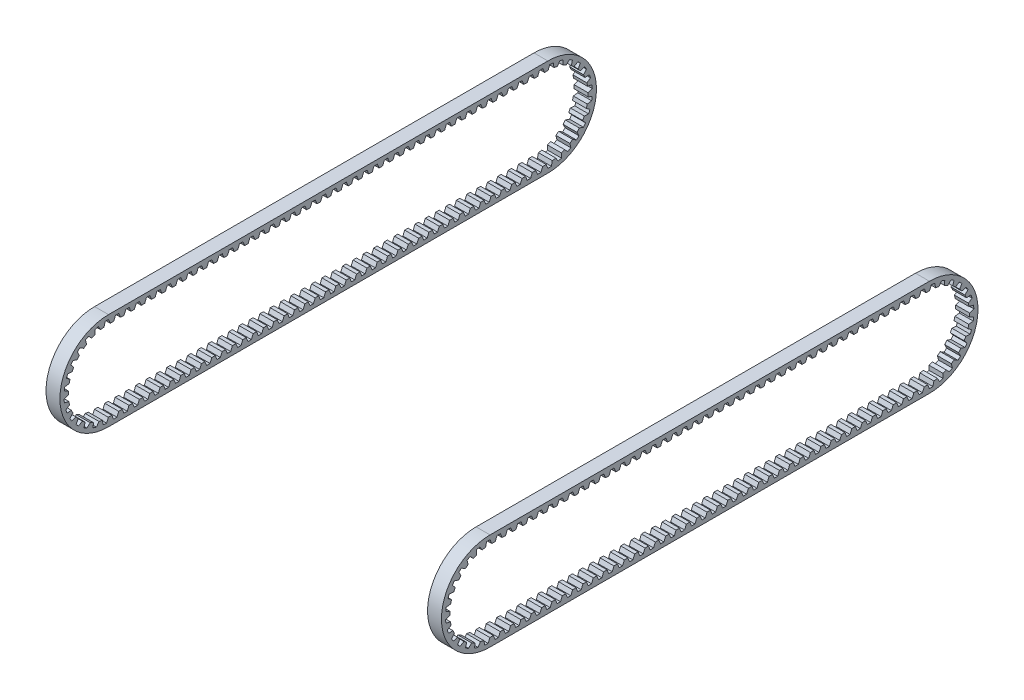
from build123d import *

# Parameters (mm, degrees)
EXTRUDE_THIN1_DEPTH = 2.000000064
BOSS_EXTRUDE1_DEPTH = 4.000000128
CRVPATTERN1_START   = 52.812499888
CRVPATTERN1_DEPTH   = 4.000000128


# Read off the part's stored shape, not the designer's step: CrvPattern1
with BuildPart() as part:
    # Sketch1 → Extrude-Thin1 (new, symmetric)
    with BuildSketch(Plane.ZY.offset(-54.812499952)):
        with BuildLine():
            Line((0, -13.959015611), (126.249998656, -13.959015611))
            ThreePointArc((126.249998656, -13.959015611), (140.209014267, 0), (126.249998656, 13.959015611))
            Line((126.249998656, 13.959015611), (0, 13.959015611))
            ThreePointArc((0, 13.959015611), (-13.959015611, 0), (0, -13.959015611))
        make_face()
        with BuildLine():
            Line((0, -12.779015685), (126.249998656, -12.779015685))
            ThreePointArc((126.249998656, -12.779015685), (139.029014341, 0), (126.249998656, 12.779015685))
            Line((126.249998656, 12.779015685), (0, 12.779015685))
            ThreePointArc((0, 12.779015685), (-12.779015685, 0), (0, -12.779015685))
        make_face(mode=Mode.SUBTRACT)
    extrude(amount=EXTRUDE_THIN1_DEPTH, both=True)

    # Sketch3 → Boss-Extrude1 (add)
    with BuildSketch(Plane.ZY.offset(-52.812499888)):
        Polygon((124.249998592, 12.779015685), (124.749998608, 11.559015585), (125.249998624, 11.559015585), (125.74999864, 11.559015585), (126.249998656, 12.779015685), (125.249998624, 12.779015685), align=None)
    extrude(amount=-BOSS_EXTRUDE1_DEPTH)

    # CrvPattern1 outline → CrvPattern1 (add)
    with BuildSketch(Plane.YZ.offset(CRVPATTERN1_START)):
        with BuildLine():
            Line((12.779015685, 1.452653318), (11.559015585, 0.952653302))
            Line((11.559015585, 0.952653302), (11.559015585, -0.04734673))
            Line((11.559015585, -0.04734673), (12.767490044, -0.542623123))
            ThreePointArc((12.767490044, -0.542623123), (12.77613395, -0.271372757), (12.779015685, 0))
            Line((12.779015685, 0), (12.779015685, 1.452653318))
        make_face()
        Polygon((11.559015585, 121.778633243), (12.779015685, 121.278633227), (12.779015685, 123.278633291), (11.559015585, 122.778633275), align=None)
        Polygon((11.559015585, 118.807267878), (12.779015685, 118.307267862), (12.779015685, 120.307267926), (11.559015585, 119.80726791), align=None)
        Polygon((11.559015585, 115.835902512), (12.779015685, 115.335902496), (12.779015685, 117.33590256), (11.559015585, 116.835902544), align=None)
        Polygon((11.559015585, 112.864537147), (12.779015685, 112.364537131), (12.779015685, 114.364537195), (11.559015585, 113.864537179), align=None)
        Polygon((11.559015585, 109.893171782), (12.779015685, 109.393171766), (12.779015685, 111.39317183), (11.559015585, 110.893171814), align=None)
        Polygon((11.559015585, 106.921806417), (12.779015685, 106.421806401), (12.779015685, 108.421806465), (11.559015585, 107.921806449), align=None)
        Polygon((11.559015585, 103.950441052), (12.779015685, 103.450441036), (12.779015685, 105.4504411), (11.559015585, 104.950441084), align=None)
        Polygon((11.559015585, 100.979075686), (12.779015685, 100.47907567), (12.779015685, 102.479075734), (11.559015585, 101.979075718), align=None)
        Polygon((11.559015585, 98.007710321), (12.779015685, 97.507710305), (12.779015685, 99.507710369), (11.559015585, 99.007710353), align=None)
        Polygon((11.559015585, 95.036344956), (12.779015685, 94.53634494), (12.779015685, 96.536345004), (11.559015585, 96.036344988), align=None)
        Polygon((11.559015585, 92.064979591), (12.779015685, 91.564979575), (12.779015685, 93.564979639), (11.559015585, 93.064979623), align=None)
        Polygon((11.559015585, 89.093614226), (12.779015685, 88.59361421), (12.779015685, 90.593614274), (11.559015585, 90.093614258), align=None)
        Polygon((11.559015585, 86.122248861), (12.779015685, 85.622248845), (12.779015685, 87.622248909), (11.559015585, 87.122248893), align=None)
        Polygon((11.559015585, 83.150883495), (12.779015685, 82.650883479), (12.779015685, 84.650883543), (11.559015585, 84.150883527), align=None)
        Polygon((11.559015585, 80.17951813), (12.779015685, 79.679518114), (12.779015685, 81.679518178), (11.559015585, 81.179518162), align=None)
        Polygon((11.559015585, 77.208152765), (12.779015685, 76.708152749), (12.779015685, 78.708152813), (11.559015585, 78.208152797), align=None)
        Polygon((11.559015585, 74.2367874), (12.779015685, 73.736787384), (12.779015685, 75.736787448), (11.559015585, 75.236787432), align=None)
        Polygon((11.559015585, 71.265422035), (12.779015685, 70.765422019), (12.779015685, 72.765422083), (11.559015585, 72.265422067), align=None)
        Polygon((11.559015585, 68.294056669), (12.779015685, 67.794056653), (12.779015685, 69.794056717), (11.559015585, 69.294056701), align=None)
        Polygon((11.559015585, 65.322691304), (12.779015685, 64.822691288), (12.779015685, 66.822691352), (11.559015585, 66.322691336), align=None)
        Polygon((11.559015585, 62.351325939), (12.779015685, 61.851325923), (12.779015685, 63.851325987), (11.559015585, 63.351325971), align=None)
        Polygon((11.559015585, 59.379960574), (12.779015685, 58.879960558), (12.779015685, 60.879960622), (11.559015585, 60.379960606), align=None)
        Polygon((11.559015585, 56.408595209), (12.779015685, 55.908595193), (12.779015685, 57.908595257), (11.559015585, 57.408595241), align=None)
        Polygon((11.559015585, 53.437229843), (12.779015685, 52.937229827), (12.779015685, 54.937229891), (11.559015585, 54.437229875), align=None)
        Polygon((11.559015585, 50.465864478), (12.779015685, 49.965864462), (12.779015685, 51.965864526), (11.559015585, 51.46586451), align=None)
        Polygon((11.559015585, 47.494499113), (12.779015685, 46.994499097), (12.779015685, 48.994499161), (11.559015585, 48.494499145), align=None)
        Polygon((11.559015585, 44.523133748), (12.779015685, 44.023133732), (12.779015685, 46.023133796), (11.559015585, 45.52313378), align=None)
        Polygon((11.559015585, 41.551768383), (12.779015685, 41.051768367), (12.779015685, 43.051768431), (11.559015585, 42.551768415), align=None)
        Polygon((11.559015585, 38.580403018), (12.779015685, 38.080403002), (12.779015685, 40.080403065), (11.559015585, 39.580403049), align=None)
        Polygon((11.559015585, 35.609037652), (12.779015685, 35.109037636), (12.779015685, 37.1090377), (11.559015585, 36.609037684), align=None)
        Polygon((11.559015585, 32.637672287), (12.779015685, 32.137672271), (12.779015685, 34.137672335), (11.559015585, 33.637672319), align=None)
        Polygon((11.559015585, 29.666306922), (12.779015685, 29.166306906), (12.779015685, 31.16630697), (11.559015585, 30.666306954), align=None)
        Polygon((11.559015585, 26.694941557), (12.779015685, 26.194941541), (12.779015685, 28.194941605), (11.559015585, 27.694941589), align=None)
        Polygon((11.559015585, 23.723576192), (12.779015685, 23.223576176), (12.779015685, 25.22357624), (11.559015585, 24.723576224), align=None)
        Polygon((11.559015585, 20.752210826), (12.779015685, 20.25221081), (12.779015685, 22.252210874), (11.559015585, 21.752210858), align=None)
        Polygon((11.559015585, 17.780845461), (12.779015685, 17.280845445), (12.779015685, 19.280845509), (11.559015585, 18.780845493), align=None)
        Polygon((11.559015585, 14.809480096), (12.779015685, 14.30948008), (12.779015685, 16.309480144), (11.559015585, 15.809480128), align=None)
        Polygon((11.559015585, 11.838114731), (12.779015685, 11.338114715), (12.779015685, 13.338114779), (11.559015585, 12.838114763), align=None)
        Polygon((11.559015585, 8.866749366), (12.779015685, 8.36674935), (12.779015685, 10.366749414), (11.559015585, 9.866749398), align=None)
        Polygon((11.559015585, 5.895384), (12.779015685, 5.395383984), (12.779015685, 7.395384048), (11.559015585, 6.895384032), align=None)
        Polygon((11.559015585, 2.924018635), (12.779015685, 2.424018619), (12.779015685, 4.424018683), (11.559015585, 3.924018667), align=None)
        with BuildLine():
            ThreePointArc((12.740999455, 127.234973155), (12.627259855, 128.213554214), (12.43847286, 129.180465305))
            Line((12.43847286, 129.180465305), (11.344920393, 128.52015781))
            Line((11.344920393, 128.52015781), (11.498575077, 127.532033171))
            Line((11.498575077, 127.532033171), (12.740999455, 127.234973155))
        make_face()
        with BuildLine():
            ThreePointArc((12.171159238, 130.144369553), (11.83498647, 131.070407056), (11.428475013, 131.967795501))
            Line((11.428475013, 131.967795501), (10.516505503, 131.073270711))
            Line((10.516505503, 131.073270711), (10.893718323, 130.147144072))
            Line((10.893718323, 130.147144072), (12.171159238, 130.144369553))
        make_face()
        with BuildLine():
            ThreePointArc((10.946243023, 132.844163163), (10.405730574, 133.667815929), (9.80337391, 134.447382499))
            Line((9.80337391, 134.447382499), (9.12207137, 133.366785517))
            Line((9.12207137, 133.366785517), (9.702539983, 132.552502855))
            Line((9.702539983, 132.552502855), (10.946243023, 132.844163163))
        make_face()
        with BuildLine():
            ThreePointArc((9.132178238, 135.189045725), (8.416417562, 135.865983124), (7.650635724, 136.485769994))
            Line((7.650635724, 136.485769994), (7.236669213, 135.277260699))
            Line((7.236669213, 135.277260699), (7.989151643, 134.618648327))
            Line((7.989151643, 134.618648327), (9.132178238, 135.189045725))
        make_face()
        with BuildLine():
            ThreePointArc((6.826601457, 137.052810994), (5.974116219, 137.546598909), (5.086125109, 137.973247918))
            Line((5.086125109, 137.973247918), (4.961775126, 136.701870684))
            Line((4.961775126, 136.701870684), (5.845771272, 136.23437643))
            Line((5.845771272, 136.23437643), (6.826601457, 137.052810994))
        make_face()
        with BuildLine():
            ThreePointArc((4.153603408, 138.335147418), (3.210276057, 138.619209201), (2.247869123, 138.82975725))
            Line((2.247869123, 138.82975725), (2.419828433, 137.563940129))
            Line((2.419828433, 137.563940129), (3.387759865, 137.312725463))
            Line((3.387759865, 137.312725463), (4.153603408, 138.335147418))
        make_face()
        with BuildLine():
            ThreePointArc((1.257050162, 138.967037099), (0.273652454, 139.02608398), (-0.711371649, 139.009198954))
            Line((-0.711371649, 139.009198954), (-0.252358238, 137.817070741))
            Line((-0.252358238, 137.817070741), (0.747412483, 137.795656536))
            Line((0.747412483, 137.795656536), (1.257050162, 138.967037099))
        make_face()
        with BuildLine():
            ThreePointArc((-1.707160023, 138.914470478), (-2.677699669, 138.745324437), (-3.632324984, 138.501915122))
            Line((-3.632324984, 138.501915122), (-2.910962488, 137.447638528))
            Line((-2.910962488, 137.447638528), (-1.933162125, 137.657177339))
            Line((-1.933162125, 137.657177339), (-1.707160023, 138.914470478))
        make_face()
        with BuildLine():
            ThreePointArc((-4.579487461, 138.180276795), (-5.48493267, 137.792041607), (-6.357779364, 137.335208777))
            Line((-6.357779364, 137.335208777), (-5.412892947, 136.475527065))
            Line((-5.412892947, 136.475527065), (-4.509690102, 136.904741097))
            Line((-4.509690102, 136.904741097), (-4.579487461, 138.180276795))
        make_face()
        with BuildLine():
            ThreePointArc((-7.205337775, 136.803971814), (-7.996955685, 136.21754307), (-8.741045414, 135.571874376))
            Line((-8.741045414, 135.571874376), (-7.623490741, 134.953057326))
            Line((-7.623490741, 134.953057326), (-6.843497589, 135.578845426))
            Line((-6.843497589, 135.578845426), (-7.205337775, 136.803971814))
        make_face()
        with BuildLine():
            ThreePointArc((-9.443382479, 134.859631007), (-10.07856664, 134.106571469), (-10.653851014, 133.306818084))
            Line((-10.653851014, 133.306818084), (-9.423777102, 132.96217166))
            Line((-9.423777102, 132.96217166), (-8.808974424, 133.750852667))
            Line((-8.808974424, 133.750852667), (-9.443382479, 134.859631007))
        make_face()
        with BuildLine():
            ThreePointArc((-11.173165557, 132.451902663), (-11.617729094, 131.572743491), (-11.993245164, 130.661949734))
            Line((-11.993245164, 130.661949734), (-10.716857036, 130.610023493))
            Line((-10.716857036, 130.610023493), (-10.300334736, 131.519149027))
            Line((-10.300334736, 131.519149027), (-11.173165557, 132.451902663))
        make_face()
        with BuildLine():
            ThreePointArc((-12.301586642, 129.71037551), (-12.531602261, 128.752434801), (-12.687139005, 127.779621403))
            Line((-12.687139005, 127.779621403), (-11.433134409, 128.023210117))
            Line((-11.433134409, 128.023210117), (-11.237310545, 129.003849234))
            Line((-11.237310545, 129.003849234), (-12.301586642, 129.71037551))
        make_face()
        with BuildLine():
            Line((-12.779015685, 126.249998656), (-12.779015685, 124.797345338))
            Line((-12.779015685, 124.797345338), (-11.559015585, 125.297345354))
            Line((-11.559015585, 125.297345354), (-11.559015585, 126.297345386))
            Line((-11.559015585, 126.297345386), (-12.767490044, 126.792621779))
            ThreePointArc((-12.767490044, 126.792621779), (-12.77613395, 126.521371413), (-12.779015685, 126.249998656))
        make_face()
        Polygon((-12.779015685, 123.825980037), (-12.779015685, 121.825979973), (-11.559015585, 122.325979989), (-11.559015585, 123.325980021), align=None)
        Polygon((-12.779015685, 120.854614672), (-12.779015685, 118.854614608), (-11.559015585, 119.354614624), (-11.559015585, 120.354614656), align=None)
        Polygon((-12.779015685, 117.883249306), (-12.779015685, 115.883249242), (-11.559015585, 116.383249258), (-11.559015585, 117.38324929), align=None)
        Polygon((-12.779015685, 114.911883941), (-12.779015685, 112.911883877), (-11.559015585, 113.411883893), (-11.559015585, 114.411883925), align=None)
        Polygon((-12.779015685, 111.940518576), (-12.779015685, 109.940518512), (-11.559015585, 110.440518528), (-11.559015585, 111.44051856), align=None)
        Polygon((-12.779015685, 108.969153211), (-12.779015685, 106.969153147), (-11.559015585, 107.469153163), (-11.559015585, 108.469153195), align=None)
        Polygon((-12.779015685, 105.997787846), (-12.779015685, 103.997787782), (-11.559015585, 104.497787798), (-11.559015585, 105.49778783), align=None)
        Polygon((-12.779015685, 103.02642248), (-12.779015685, 101.026422416), (-11.559015585, 101.526422432), (-11.559015585, 102.526422464), align=None)
        Polygon((-12.779015685, 100.055057115), (-12.779015685, 98.055057051), (-11.559015585, 98.555057067), (-11.559015585, 99.555057099), align=None)
        Polygon((-12.779015685, 97.08369175), (-12.779015685, 95.083691686), (-11.559015585, 95.583691702), (-11.559015585, 96.583691734), align=None)
        Polygon((-12.779015685, 94.112326385), (-12.779015685, 92.112326321), (-11.559015585, 92.612326337), (-11.559015585, 93.612326369), align=None)
        Polygon((-12.779015685, 91.14096102), (-12.779015685, 89.140960956), (-11.559015585, 89.640960972), (-11.559015585, 90.640961004), align=None)
        Polygon((-12.779015685, 88.169595655), (-12.779015685, 86.169595591), (-11.559015585, 86.669595607), (-11.559015585, 87.669595639), align=None)
        Polygon((-12.779015685, 85.198230289), (-12.779015685, 83.198230225), (-11.559015585, 83.698230241), (-11.559015585, 84.698230273), align=None)
        Polygon((-12.779015685, 82.226864924), (-12.779015685, 80.22686486), (-11.559015585, 80.726864876), (-11.559015585, 81.726864908), align=None)
        Polygon((-12.779015685, 79.255499559), (-12.779015685, 77.255499495), (-11.559015585, 77.755499511), (-11.559015585, 78.755499543), align=None)
        Polygon((-12.779015685, 76.284134194), (-12.779015685, 74.28413413), (-11.559015585, 74.784134146), (-11.559015585, 75.784134178), align=None)
        Polygon((-12.779015685, 73.312768829), (-12.779015685, 71.312768765), (-11.559015585, 71.812768781), (-11.559015585, 72.812768813), align=None)
        Polygon((-12.779015685, 70.341403463), (-12.779015685, 68.341403399), (-11.559015585, 68.841403415), (-11.559015585, 69.841403447), align=None)
        Polygon((-12.779015685, 67.370038098), (-12.779015685, 65.370038034), (-11.559015585, 65.87003805), (-11.559015585, 66.870038082), align=None)
        Polygon((-12.779015685, 64.398672733), (-12.779015685, 62.398672669), (-11.559015585, 62.898672685), (-11.559015585, 63.898672717), align=None)
        Polygon((-12.779015685, 61.427307368), (-12.779015685, 59.427307304), (-11.559015585, 59.92730732), (-11.559015585, 60.927307352), align=None)
        Polygon((-12.779015685, 58.455942003), (-12.779015685, 56.455941939), (-11.559015585, 56.955941955), (-11.559015585, 57.955941987), align=None)
        Polygon((-12.779015685, 55.484576637), (-12.779015685, 53.484576573), (-11.559015585, 53.984576589), (-11.559015585, 54.984576621), align=None)
        Polygon((-12.779015685, 52.513211272), (-12.779015685, 50.513211208), (-11.559015585, 51.013211224), (-11.559015585, 52.013211256), align=None)
        Polygon((-12.779015685, 49.541845907), (-12.779015685, 47.541845843), (-11.559015585, 48.041845859), (-11.559015585, 49.041845891), align=None)
        Polygon((-12.779015685, 46.570480542), (-12.779015685, 44.570480478), (-11.559015585, 45.070480494), (-11.559015585, 46.070480526), align=None)
        Polygon((-12.779015685, 43.599115177), (-12.779015685, 41.599115113), (-11.559015585, 42.099115129), (-11.559015585, 43.099115161), align=None)
        Polygon((-12.779015685, 40.627749811), (-12.779015685, 38.627749747), (-11.559015585, 39.127749763), (-11.559015585, 40.127749795), align=None)
        Polygon((-12.779015685, 37.656384446), (-12.779015685, 35.656384382), (-11.559015585, 36.156384398), (-11.559015585, 37.15638443), align=None)
        Polygon((-12.779015685, 34.685019081), (-12.779015685, 32.685019017), (-11.559015585, 33.185019033), (-11.559015585, 34.185019065), align=None)
        Polygon((-12.779015685, 31.713653716), (-12.779015685, 29.713653652), (-11.559015585, 30.213653668), (-11.559015585, 31.2136537), align=None)
        Polygon((-12.779015685, 28.742288351), (-12.779015685, 26.742288287), (-11.559015585, 27.242288303), (-11.559015585, 28.242288335), align=None)
        Polygon((-12.779015685, 25.770922986), (-12.779015685, 23.770922922), (-11.559015585, 24.270922938), (-11.559015585, 25.27092297), align=None)
        Polygon((-12.779015685, 22.79955762), (-12.779015685, 20.799557556), (-11.559015585, 21.299557572), (-11.559015585, 22.299557604), align=None)
        Polygon((-12.779015685, 19.828192255), (-12.779015685, 17.828192191), (-11.559015585, 18.328192207), (-11.559015585, 19.328192239), align=None)
        Polygon((-12.779015685, 16.85682689), (-12.779015685, 14.856826826), (-11.559015585, 15.356826842), (-11.559015585, 16.356826874), align=None)
        Polygon((-12.779015685, 13.885461525), (-12.779015685, 11.885461461), (-11.559015585, 12.385461477), (-11.559015585, 13.385461509), align=None)
        Polygon((-12.779015685, 10.91409616), (-12.779015685, 8.914096096), (-11.559015585, 9.414096112), (-11.559015585, 10.414096144), align=None)
        Polygon((-12.779015685, 7.942730794), (-12.779015685, 5.94273073), (-11.559015585, 6.442730746), (-11.559015585, 7.442730778), align=None)
        Polygon((-12.779015685, 4.971365429), (-12.779015685, 2.971365365), (-11.559015585, 3.471365381), (-11.559015585, 4.471365413), align=None)
        Polygon((-12.779015685, 2.000000064), (-12.779015685, 0), (-11.559015585, 0.500000016), (-11.559015585, 1.500000048), align=None)
        with BuildLine():
            ThreePointArc((-12.740999455, -0.984974499), (-12.627259855, -1.963555558), (-12.43847286, -2.930466649))
            Line((-12.43847286, -2.930466649), (-11.344920393, -2.270159154))
            Line((-11.344920393, -2.270159154), (-11.498575077, -1.282034515))
            Line((-11.498575077, -1.282034515), (-12.740999455, -0.984974499))
        make_face()
        with BuildLine():
            ThreePointArc((-12.171159238, -3.894370897), (-11.83498647, -4.8204084), (-11.428475013, -5.717796845))
            Line((-11.428475013, -5.717796845), (-10.516505503, -4.823272055))
            Line((-10.516505503, -4.823272055), (-10.893718323, -3.897145416))
            Line((-10.893718323, -3.897145416), (-12.171159238, -3.894370897))
        make_face()
        with BuildLine():
            ThreePointArc((-10.946243023, -6.594164507), (-10.405730574, -7.417817273), (-9.80337391, -8.197383843))
            Line((-9.80337391, -8.197383843), (-9.12207137, -7.116786861))
            Line((-9.12207137, -7.116786861), (-9.702539983, -6.302504199))
            Line((-9.702539983, -6.302504199), (-10.946243023, -6.594164507))
        make_face()
        with BuildLine():
            ThreePointArc((-9.132178238, -8.939047069), (-8.416417562, -9.615984468), (-7.650635724, -10.235771338))
            Line((-7.650635724, -10.235771338), (-7.236669213, -9.027262043))
            Line((-7.236669213, -9.027262043), (-7.989151643, -8.368649671))
            Line((-7.989151643, -8.368649671), (-9.132178238, -8.939047069))
        make_face()
        with BuildLine():
            ThreePointArc((-6.826601457, -10.802812338), (-5.974116219, -11.296600253), (-5.086125109, -11.723249262))
            Line((-5.086125109, -11.723249262), (-4.961775126, -10.451872028))
            Line((-4.961775126, -10.451872028), (-5.845771272, -9.984377774))
            Line((-5.845771272, -9.984377774), (-6.826601457, -10.802812338))
        make_face()
        with BuildLine():
            ThreePointArc((-4.153603408, -12.085148762), (-3.210276057, -12.369210545), (-2.247869123, -12.579758594))
            Line((-2.247869123, -12.579758594), (-2.419828433, -11.313941473))
            Line((-2.419828433, -11.313941473), (-3.387759865, -11.062726807))
            Line((-3.387759865, -11.062726807), (-4.153603408, -12.085148762))
        make_face()
        with BuildLine():
            ThreePointArc((-1.257050162, -12.717038443), (-0.273652454, -12.776085324), (0.711371649, -12.759200298))
            Line((0.711371649, -12.759200298), (0.252358238, -11.567072085))
            Line((0.252358238, -11.567072085), (-0.747412483, -11.54565788))
            Line((-0.747412483, -11.54565788), (-1.257050162, -12.717038443))
        make_face()
        with BuildLine():
            ThreePointArc((1.707160023, -12.664471822), (2.677699669, -12.495325781), (3.632324984, -12.251916466))
            Line((3.632324984, -12.251916466), (2.910962488, -11.197639872))
            Line((2.910962488, -11.197639872), (1.933162125, -11.407178683))
            Line((1.933162125, -11.407178683), (1.707160023, -12.664471822))
        make_face()
        with BuildLine():
            ThreePointArc((4.579487461, -11.930278139), (5.48493267, -11.542042951), (6.357779364, -11.085210121))
            Line((6.357779364, -11.085210121), (5.412892947, -10.225528409))
            Line((5.412892947, -10.225528409), (4.509690102, -10.654742441))
            Line((4.509690102, -10.654742441), (4.579487461, -11.930278139))
        make_face()
        with BuildLine():
            ThreePointArc((7.205337775, -10.553973158), (7.996955685, -9.967544414), (8.741045414, -9.32187572))
            Line((8.741045414, -9.32187572), (7.623490741, -8.70305867))
            Line((7.623490741, -8.70305867), (6.843497589, -9.32884677))
            Line((6.843497589, -9.32884677), (7.205337775, -10.553973158))
        make_face()
        with BuildLine():
            ThreePointArc((9.443382479, -8.609632351), (10.07856664, -7.856572813), (10.653851014, -7.056819428))
            Line((10.653851014, -7.056819428), (9.423777102, -6.712173004))
            Line((9.423777102, -6.712173004), (8.808974424, -7.500854011))
            Line((8.808974424, -7.500854011), (9.443382479, -8.609632351))
        make_face()
        with BuildLine():
            ThreePointArc((11.173165557, -6.201904007), (11.617729094, -5.322744835), (11.993245164, -4.411951078))
            Line((11.993245164, -4.411951078), (10.716857036, -4.360024837))
            Line((10.716857036, -4.360024837), (10.300334736, -5.269150371))
            Line((10.300334736, -5.269150371), (11.173165557, -6.201904007))
        make_face()
        with BuildLine():
            ThreePointArc((12.301586642, -3.460376854), (12.531602261, -2.502436145), (12.687139005, -1.529622747))
            Line((12.687139005, -1.529622747), (11.433134409, -1.773211461))
            Line((11.433134409, -1.773211461), (11.237310545, -2.753850578))
            Line((11.237310545, -2.753850578), (12.301586642, -3.460376854))
        make_face()
    extrude(amount=CRVPATTERN1_DEPTH)


with BuildPart() as body_2:
    # Mirror1: mirrored copy
    add(part.part.mirror(Plane(origin=(0, 0, 0), x_dir=(0, 0, 1), z_dir=(1, 0, 0))))


solid = Compound([part.part, body_2.part])
